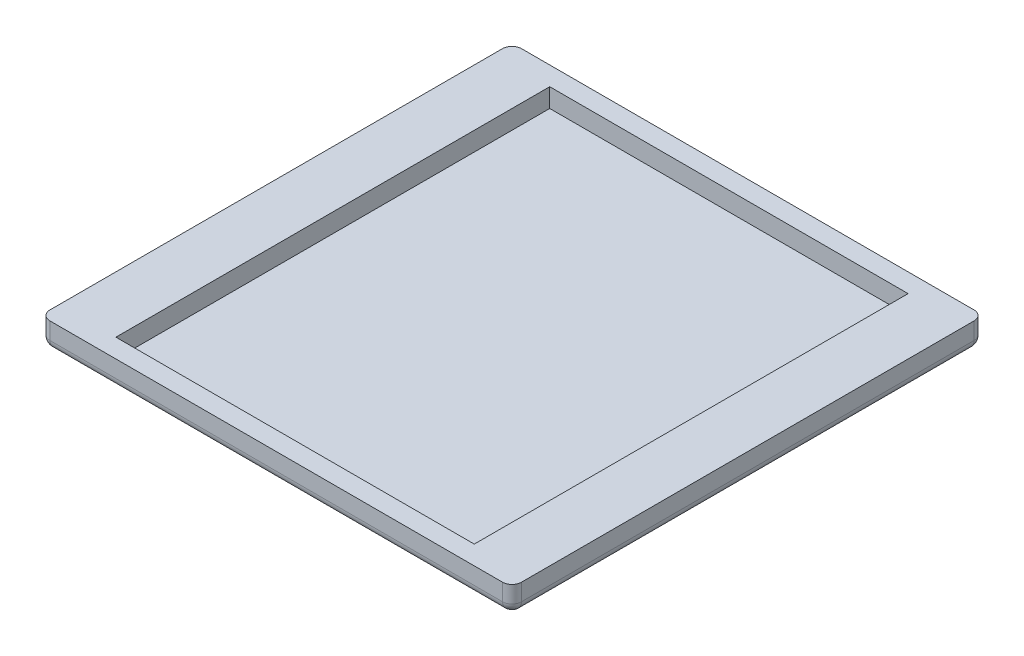
from build123d import *

# Parameters (mm, degrees)
SKETCH1_W          = 250
SKETCH1_H          = 250
BASE_DEPTH         = 14
SKETCH3_W          = 190
SKETCH3_H          = 230
CUT_EXTRUDE1_DEPTH = 10
FILLET1_R          = 5
FILLET2_R          = 5


with BuildPart() as part:
    # Sketch1 → Base (new body)
    with BuildSketch(Plane(origin=(0, 0, 0), x_dir=(1, 0, 0), z_dir=(0, 1, 0))):
        Rectangle(SKETCH1_W, SKETCH1_H)
    extrude(amount=BASE_DEPTH)

    # Sketch3 → Cut-Extrude1 (cut)
    with BuildSketch(Plane(origin=(0, 14, 0), x_dir=(1, 0, 0), z_dir=(0, 1, 0))):
        Rectangle(SKETCH3_W, SKETCH3_H)
    extrude(amount=-CUT_EXTRUDE1_DEPTH, mode=Mode.SUBTRACT)

    # Fillet1
    fillet1_edges = [part.edges().sort_by_distance(p)[0] for p in [
        (0, 0, 125),
        (-125, 0, 0),
        (0, 0, -125),
        (125, 0, 0),
    ]]
    fillet(fillet1_edges, radius=FILLET1_R)

    # Fillet2
    # the kernel refuses this fillet: 5 mm, written as the material it takes off along each edge
    with BuildSketch(Plane(origin=(120, 5, 120), x_dir=(1, 0, 0), z_dir=(0, 0, 1))) as fillet2_piece_1_section:
        Polygon((0, 0), (FILLET2_R, 0), (FILLET2_R, -FILLET2_R), (0, -FILLET2_R), align=None)
    fillet2_piece_1 = extrude(amount=FILLET2_R, mode=Mode.PRIVATE)
    fillet2_piece_1 = fillet2_piece_1 - Plane(origin=(120, 5, 120), x_dir=(-0.7071067811865475, 0.7071067811865475, 0), z_dir=(0, 0, 1)) * Sphere(FILLET2_R, mode=Mode.PRIVATE)
    add(fillet2_piece_1, mode=Mode.SUBTRACT)
    with BuildSketch(Plane(origin=(-120, 5, 120), x_dir=(-1, 0, 0), z_dir=(0, 0, 1))) as fillet2_piece_2_section:
        Polygon((0, 0), (FILLET2_R, 0), (FILLET2_R, FILLET2_R), (0, FILLET2_R), align=None)
    fillet2_piece_2 = extrude(amount=FILLET2_R, mode=Mode.PRIVATE)
    fillet2_piece_2 = fillet2_piece_2 - Plane(origin=(-120, 5, 120), x_dir=(0.7071067811865475, 0.7071067811865475, 0), z_dir=(0, 0, 1)) * Sphere(FILLET2_R, mode=Mode.PRIVATE)
    add(fillet2_piece_2, mode=Mode.SUBTRACT)
    with BuildSketch(Plane(origin=(120, 5, -120), x_dir=(0, 0, -1), z_dir=(1, 0, 0))) as fillet2_piece_3_section:
        Polygon((0, 0), (FILLET2_R, 0), (FILLET2_R, -FILLET2_R), (0, -FILLET2_R), align=None)
    fillet2_piece_3 = extrude(amount=FILLET2_R, mode=Mode.PRIVATE)
    fillet2_piece_3 = fillet2_piece_3 - Plane(origin=(120, 5, -120), x_dir=(0, 0.7071067811865475, 0.7071067811865475), z_dir=(1, 0, 0)) * Sphere(FILLET2_R, mode=Mode.PRIVATE)
    add(fillet2_piece_3, mode=Mode.SUBTRACT)
    with BuildSketch(Plane(origin=(-120, 5, -120), x_dir=(0, 0, -1), z_dir=(-1, 0, 0))) as fillet2_piece_4_section:
        Polygon((0, 0), (FILLET2_R, 0), (FILLET2_R, FILLET2_R), (0, FILLET2_R), align=None)
    fillet2_piece_4 = extrude(amount=FILLET2_R, mode=Mode.PRIVATE)
    fillet2_piece_4 = fillet2_piece_4 - Plane(origin=(-120, 5, -120), x_dir=(0, 0.7071067811865475, 0.7071067811865475), z_dir=(-1, 0, 0)) * Sphere(FILLET2_R, mode=Mode.PRIVATE)
    add(fillet2_piece_4, mode=Mode.SUBTRACT)
    with BuildSketch(Plane(origin=(125, 5, 125), x_dir=(-1, 0, 0), z_dir=(0, 1, 0)), Plane(origin=(125, 5, -125), x_dir=(0, 0, 1), z_dir=(0, 1, 0))) as fillet2_piece_5:
        with BuildLine():
            CenterArc((FILLET2_R, -FILLET2_R), FILLET2_R, 90, 90)
            Line((0, -FILLET2_R), (0, 0))
            Line((0, 0), (FILLET2_R, 0))
        make_face()
    extrude(amount=21.5, mode=Mode.SUBTRACT)
    with BuildSketch(Plane(origin=(-125, 5, 125), x_dir=(1, 0, 0), z_dir=(0, 1, 0)), Plane(origin=(-125, 5, -125), x_dir=(0, 0, 1), z_dir=(0, 1, 0))) as fillet2_piece_6:
        with BuildLine():
            CenterArc((FILLET2_R, FILLET2_R), FILLET2_R, 180, 90)
            Line((0, FILLET2_R), (0, 0))
            Line((0, 0), (FILLET2_R, 0))
        make_face()
    extrude(amount=21.5, mode=Mode.SUBTRACT)


solid = part.part
